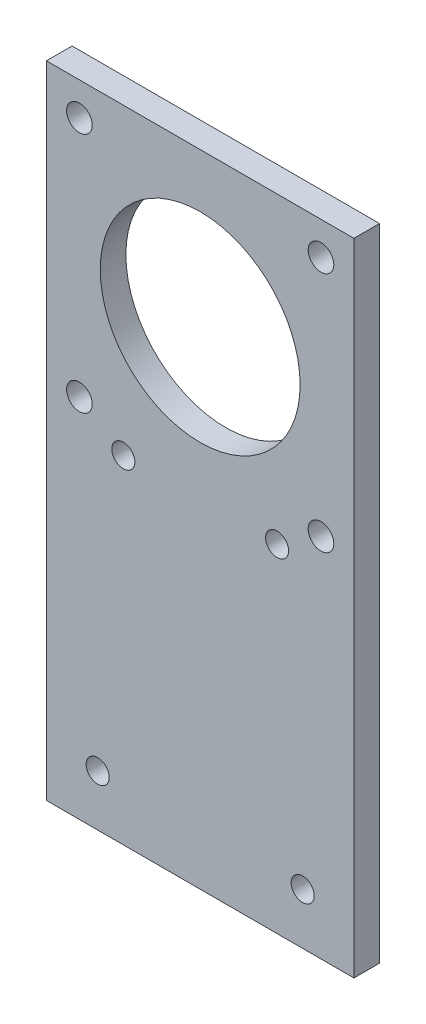
from build123d import *

# Parameters (mm, degrees)
SKETCH_1_W          = 60
SKETCH_1_H          = 125
EXTRUDE_1_DEPTH     = 5
SKETCH_4_R          = 19.5
CUT_EXTRUDE_2_DEPTH = 10
SKETCH_2_R          = 2.5
CUT_EXTRUDE_1_DEPTH = 5
HOLE_WIZARD_M4_1_D  = 4.5


with BuildPart() as part:
    # 스케치1 → 보스-돌출1 (new body)
    with BuildSketch(Plane.XY):
        Rectangle(SKETCH_1_W, SKETCH_1_H)
    extrude(amount=EXTRUDE_1_DEPTH)

    # 스케치4 → 컷-돌출2 (cut)
    with BuildSketch(Plane(origin=(0, 0, 0), x_dir=(-1, 0, 0), z_dir=(0, 0, -1))):
        with Locations((0, 32.5)):
            Circle(SKETCH_4_R)
    extrude(amount=-CUT_EXTRUDE_2_DEPTH, mode=Mode.SUBTRACT)

    # 스케치2 → 컷-돌출1 (cut)
    with BuildSketch(Plane.XY.offset(5)):
        with Locations((-23.57, 56.07)):
            Circle(SKETCH_2_R)
        with Locations((23.57, 56.07)):
            Circle(SKETCH_2_R)
        with Locations((-23.57, 8.93)):
            Circle(SKETCH_2_R)
        with Locations((23.57, 8.93)):
            Circle(SKETCH_2_R)
    extrude(amount=-CUT_EXTRUDE_1_DEPTH, mode=Mode.SUBTRACT)

    # M4 여유 구멍1 (through all)
    with Locations(Plane(origin=(0, 0, 0), x_dir=(-1, 0, 0), z_dir=(0, 0, -1))):
        with Locations((15, 3.3), (-15, 3.3), (-20, -52.5), (20, -52.5)):
            Hole(HOLE_WIZARD_M4_1_D / 2)


solid = part.part
